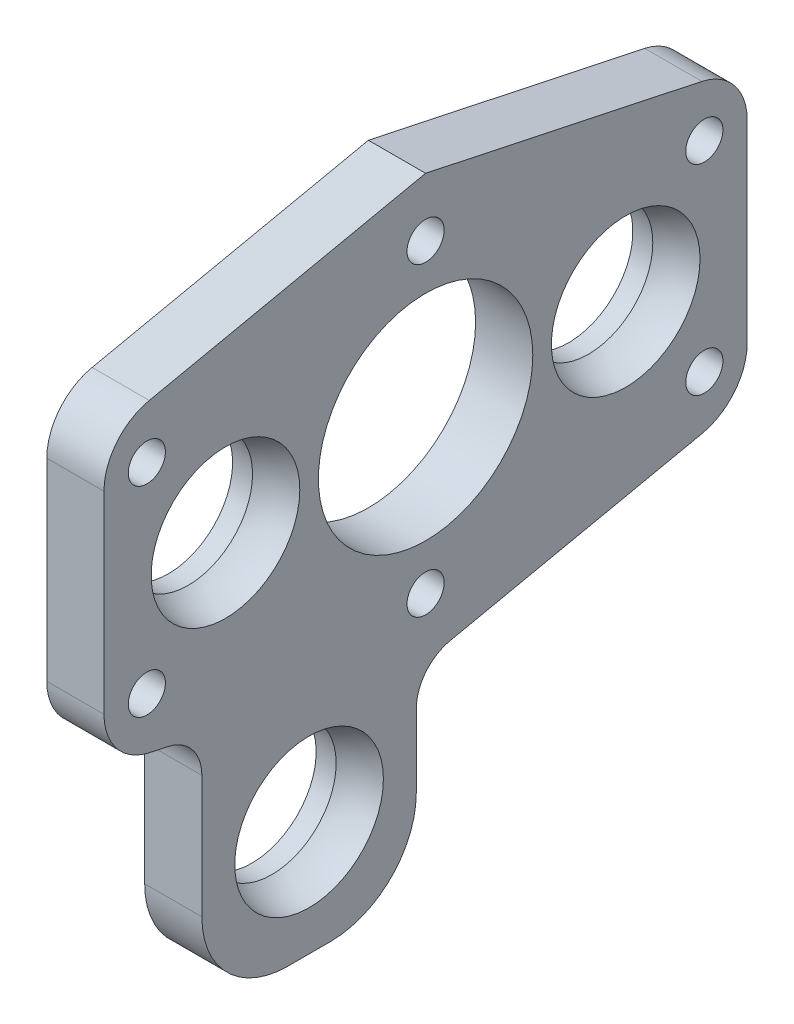
from build123d import *

# Parameters (mm, degrees)
SKETCH1_R           = 1.3
BOSS_EXTRUDE1_DEPTH = 4
SKETCH3_R           = 7.5
CUT_EXTRUDE1_DEPTH  = 52.522207254
SKETCH4_R           = 4.5
CUT_EXTRUDE2_DEPTH  = 52.522207254
BOSS_EXTRUDE2_DEPTH = 4
SKETCH7_R           = 4.5
CUT_EXTRUDE3_DEPTH  = 60.325619484
FILLET1_R           = 6
FILLET2_R           = 4
FILLET3_R           = 3
FILLET4_R           = 3


with BuildPart() as part:
    # Sketch1 → Boss-Extrude1 (new body)
    with BuildSketch(Plane(origin=(0, 0, 0), x_dir=(0, 0, -1), z_dir=(1, 0, 0))):
        Polygon((0, 0), (22.5, 4.769696007), (45, 0), (45, -20), (22.5, -24.769696007), (0, -20), align=None)
        with Locations((22.5, 0.680807118)):
            Circle(SKETCH1_R, mode=Mode.SUBTRACT)
        with Locations((22.5, -20.680807118)):
            Circle(SKETCH1_R, mode=Mode.SUBTRACT)
        with Locations((3, -3)):
            Circle(SKETCH1_R, mode=Mode.SUBTRACT)
        with Locations((42, -3)):
            Circle(SKETCH1_R, mode=Mode.SUBTRACT)
        with Locations((42, -17)):
            Circle(SKETCH1_R, mode=Mode.SUBTRACT)
        with Locations((3, -17)):
            Circle(SKETCH1_R, mode=Mode.SUBTRACT)
    extrude(amount=BOSS_EXTRUDE1_DEPTH)

    # Sketch2 → Cut-Revolve1 (revolve, cut)
    with BuildSketch(Plane(origin=(4, 0, 0), x_dir=(0, 0, -1), z_dir=(1, 0, 0))):
        with BuildLine():
            Line((3.3, -10), (13.7, -10))
            ThreePointArc((13.7, -10), (8.5, -4.8), (3.3, -10))
        make_face()
        with BuildLine():
            Line((31.3, -10), (41.7, -10))
            ThreePointArc((41.7, -10), (36.5, -4.8), (31.3, -10))
        make_face()
    revolve(axis=Axis((4, -10, -3.3), (0, 0, -1)), mode=Mode.SUBTRACT)

    # Sketch3 → Cut-Extrude1 (cut, through all)
    with BuildSketch(Plane(origin=(4, 0, 0), x_dir=(0, 0, -1), z_dir=(1, 0, 0))):
        with Locations((22.5, -10)):
            Circle(SKETCH3_R)
    extrude(amount=-CUT_EXTRUDE1_DEPTH, mode=Mode.SUBTRACT)

    # Sketch4 → Cut-Extrude2 (cut, through all)
    with BuildSketch(Plane.ZY):
        with Locations((-8.5, -10)):
            Circle(SKETCH4_R)
        with Locations((-36.5, -10)):
            Circle(SKETCH4_R)
    extrude(amount=-CUT_EXTRUDE2_DEPTH, mode=Mode.SUBTRACT)

    # Sketch5 → Boss-Extrude2 (add)
    with BuildSketch(Plane(origin=(4, 0, 0), x_dir=(0, 0, -1), z_dir=(1, 0, 0))):
        Polygon((6.847826087, -21.451646611), (21.847826087, -24.631443949), (21.847826087, -38.451646611), (6.847826087, -38.451646611), align=None)
    extrude(amount=-BOSS_EXTRUDE2_DEPTH)

    # Sketch6 → Cut-Revolve2 (revolve, cut)
    with BuildSketch(Plane(origin=(4, 0, 0), x_dir=(0, 0, -1), z_dir=(1, 0, 0))):
        with BuildLine():
            Line((14.347826087, -25.251646611), (14.347826087, -35.651646611))
            ThreePointArc((14.347826087, -35.651646611), (9.147826087, -30.451646611), (14.347826087, -25.251646611))
        make_face()
    revolve(axis=Axis((4, -25.251646611, -14.347826087), (0, -1, 0)), mode=Mode.SUBTRACT)

    # Sketch7 → Cut-Extrude3 (cut, through all)
    with BuildSketch(Plane.ZY):
        with Locations((-14.347826087, -30.451646611)):
            Circle(SKETCH7_R)
    extrude(amount=-CUT_EXTRUDE3_DEPTH, mode=Mode.SUBTRACT)

    # Fillet1
    fillet1_edges = [part.edges().sort_by_distance(p)[0] for p in [
        (2, -38.451646611, -6.847826087),
        (2, -38.451646611, -21.847826087),
    ]]
    fillet(fillet1_edges, radius=FILLET1_R)

    # Fillet2
    fillet2_edges = [part.edges().sort_by_distance(p)[0] for p in [
        (2, -20, 0),
        (2, 0, 0),
        (2, 0, -45),
        (2, -20, -45),
    ]]
    fillet(fillet2_edges, radius=FILLET2_R)

    # Fillet3
    # the kernel refuses this fillet: 3 mm, written as the material it adds along each edge
    with BuildSketch(Plane(origin=(4, -21.451646611, -6.847826087), x_dir=(0, 0.20737808726455337, 0.9782608695652173), z_dir=(-1, 0, 0))) as fillet3_piece_1:
        with BuildLine():
            CenterArc((FILLET3_R * 0.810235733018, -FILLET3_R), FILLET3_R, 90, 78.031254445)
            Line((-FILLET3_R * 0.168025136547, -FILLET3_R * 0.792621912735), (-FILLET3_R * 0.187590353938, -FILLET3_R * 0.78847435099))
            Line((-FILLET3_R * 0.187590353938, -FILLET3_R * 0.78847435099), (-FILLET3_R * 0.0162047146604, FILLET3_R * 0.02))
            Line((-FILLET3_R * 0.0162047146604, FILLET3_R * 0.02), (FILLET3_R * 0.810235733018, FILLET3_R * 0.02))
            Line((FILLET3_R * 0.810235733018, FILLET3_R * 0.02), (FILLET3_R * 0.810235733018, 0))
        make_face()
    extrude(amount=4)
    with BuildSketch(Plane(origin=(4, -24.631443949, -21.847826087), x_dir=(0, -1, 0), z_dir=(-1, 0, 0))) as fillet3_piece_2:
        with BuildLine():
            CenterArc((2.005793936, -3), FILLET3_R, 90, 38.499950409)
            Line((0.138252058, -0.652173913), (0.100901221, -0.605217391))
            ThreePointArc((0.100901221, -0.605217391), (0.010430377, -0.338529642), (-0.058695652, -0.012442685))
            Line((-0.058695652, -0.012442685), (0, 0.06))
            Line((0, 0.06), (2.005793936, 0.06))
            Line((2.005793936, 0.06), (2.005793936, 0))
        make_face()
    extrude(amount=4)

    # Fillet4
    # the kernel refuses this fillet: 3 mm, written as the material it adds along each edge
    with BuildSketch(Plane(origin=(0, -24.769696007, -22.5), x_dir=(0, -0.9692541852770001, 0.24606162708357948), z_dir=(1, 0, 0))) as fillet4_piece_1:
        with BuildLine():
            CenterArc((1.912264605, 2.907762556), FILLET4_R, 206.213326816, 78.031254445)
            Line((-0.779202353, 1.582618935), (-1.048349049, 1.450104573))
            Line((-1.048349049, 1.450104573), (-0.269146696, -0.132514362))
            Line((-0.269146696, -0.132514362), (-0.123241287, -0.273517065))
            ThreePointArc((-0.123241287, -0.273517065), (2.044416244, -0.463368157), (2.724267974, -0.290776256))
            Line((2.724267974, -0.290776256), (2.650449486, 0))
        make_face()
    extrude(amount=4)


solid = part.part
